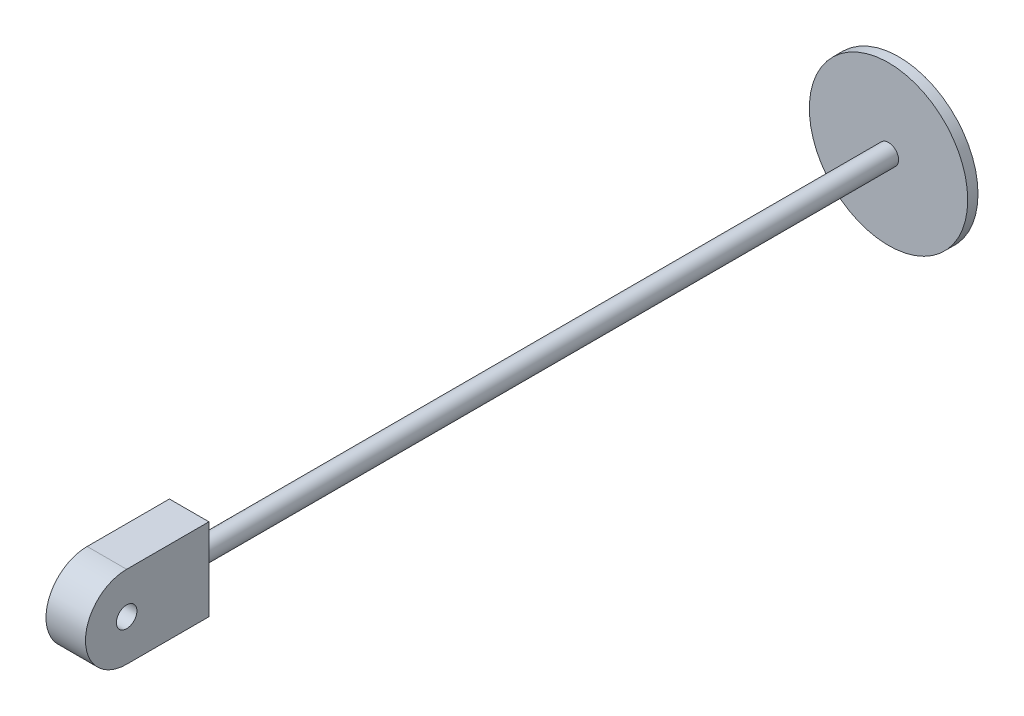
from build123d import *

# Parameters (mm, degrees)
SKETCH1_R           = 9.625
BOSS_EXTRUDE1_DEPTH = 0.625
SKETCH2_R           = 1.225
BOSS_EXTRUDE2_DEPTH = 85
BOSS_EXTRUDE3_DEPTH = 2.4
SKETCH4_R           = 1.25
CUT_EXTRUDE1_DEPTH  = 10


with BuildPart() as part:
    # Sketch1 → Boss-Extrude1 (new, symmetric)
    with BuildSketch(Plane.XY):
        Circle(SKETCH1_R)
    extrude(amount=BOSS_EXTRUDE1_DEPTH, both=True)

    # Sketch2 → Boss-Extrude2 (add)
    with BuildSketch(Plane.XY.offset(0.625)):
        Circle(SKETCH2_R)
    extrude(amount=BOSS_EXTRUDE2_DEPTH)

    # Sketch3 → Boss-Extrude3 (add, symmetric)
    with BuildSketch(Plane(origin=(0, 0, 0), x_dir=(0, 0, -1), z_dir=(1, 0, 0))):
        with BuildLine():
            Line((-85.625, 5), (-85.625, -5))
            Line((-85.625, -5), (-95.625, -5))
            ThreePointArc((-95.625, -5), (-100.625, 0), (-95.625, 5))
            Line((-95.625, 5), (-85.625, 5))
        make_face()
    extrude(amount=BOSS_EXTRUDE3_DEPTH, both=True)

    # Sketch4 → Cut-Extrude1 (cut)
    with BuildSketch(Plane.ZY.offset(2.4)):
        with Locations((95.625, 0)):
            Circle(SKETCH4_R)
    extrude(amount=-CUT_EXTRUDE1_DEPTH, mode=Mode.SUBTRACT)


solid = part.part
